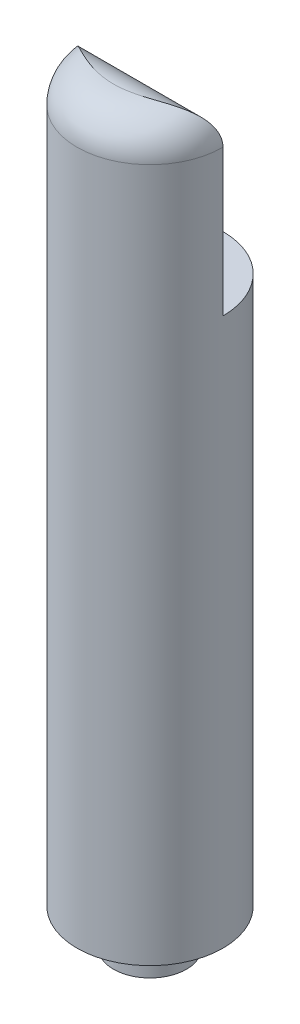
from build123d import *

# Parameters (mm, degrees)
SKETCH1_R           = 10
BOSS_EXTRUDE1_DEPTH = 100
SKETCH4_W           = 20
SKETCH4_H           = 25
CUT_EXTRUDE2_DEPTH  = 10
FILLET3_R           = 5
SKETCH3_R           = 5
BOSS_EXTRUDE3_DEPTH = 5
SKETCH7_R           = 5
CUT_EXTRUDE3_DEPTH  = 5


with BuildPart() as part:
    # Sketch1 → Boss-Extrude1 (new body)
    with BuildSketch(Plane(origin=(0, 0, 0), x_dir=(1, 0, 0), z_dir=(0, 1, 0))):
        with Locations(Location((0, 0, 0), (0, 0, 90))):
            Circle(SKETCH1_R)
    extrude(amount=BOSS_EXTRUDE1_DEPTH)

    # Sketch4 → Cut-Extrude2 (cut)
    with BuildSketch(Plane.XY):
        with Locations((0, 87.5)):
            Rectangle(SKETCH4_W, SKETCH4_H)
    extrude(amount=-CUT_EXTRUDE2_DEPTH, mode=Mode.SUBTRACT)

    # Fillet3
    fillet3_edges = [part.edges().sort_by_distance(p)[0] for p in [
        (0, 100, 0),
        (0, 100, 10),
    ]]
    fillet(fillet3_edges, radius=FILLET3_R - 0.0001)  # a hair under: the kernel refuses the full size

    # Sketch3 → Boss-Extrude3 (add)
    with BuildSketch(Plane(origin=(0, 0, 0), x_dir=(1, 0, 0), z_dir=(0, 1, 0))):
        with Locations(Location((0, 0, 0), (0, 0, 270))):
            Circle(SKETCH3_R)
    extrude(amount=-BOSS_EXTRUDE3_DEPTH)

    # Sketch7 → Cut-Extrude3 (cut)
    with BuildSketch(Plane.XY):
        with Locations(Location((0, 92.001790993, 0), (0, 0, 143.155752141))):
            Circle(SKETCH7_R)
    extrude(amount=CUT_EXTRUDE3_DEPTH, mode=Mode.SUBTRACT)


solid = part.part
